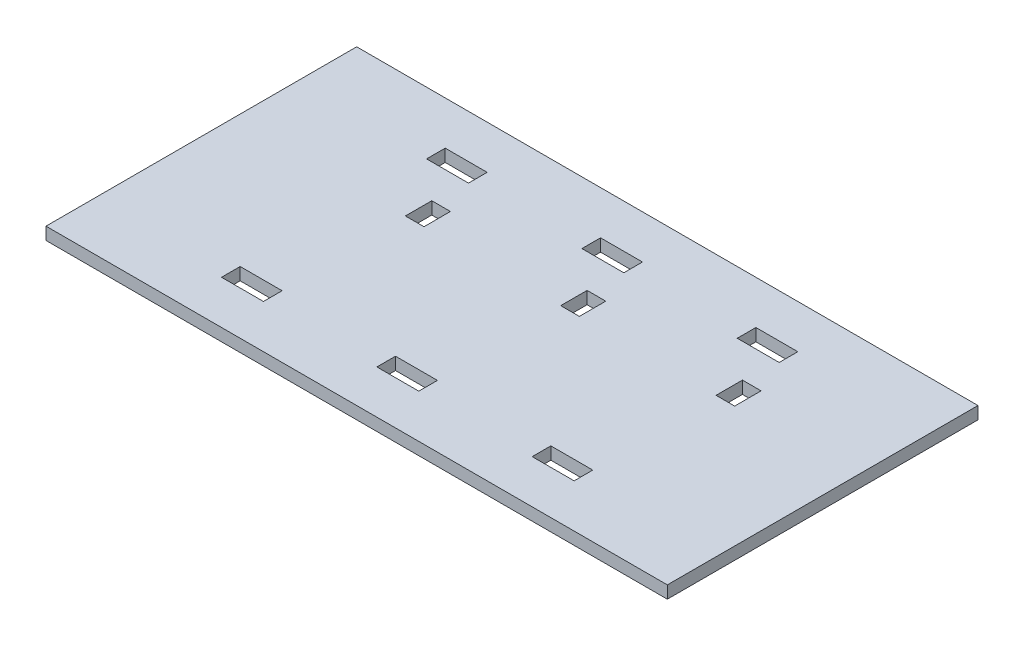
from build123d import *

# Parameters (mm, degrees)
SKETCH1_W                 = 101.6
SKETCH1_H                 = 50.8
BOSS_EXTRUDE1_DEPTH       = 2.032
SKETCH2_W                 = 3.048
SKETCH2_H                 = 4.318
WIRE_HOLE_DEPTH           = 57.832464525
SKETCH3_W                 = 6.858
SKETCH3_H                 = 3.048
CUT_EXTRUDE2_DEPTH        = 57.832464525
LPATTERN1_COUNT           = 2
LPATTERN1_PITCH           = 25.4
LPATTERN1_COUNT_DIR2      = 2
LPATTERN1_PITCH_DIR2      = 25.4
LPATTERN1_COPY_1_SKETCH_W = 6.858
LPATTERN1_COPY_1_SKETCH_H = 3.048
LPATTERN1_COPY_1_DEPTH    = 57.832464525
LPATTERN1_COPY_2_SKETCH_W = 6.858
LPATTERN1_COPY_2_SKETCH_H = 3.048
LPATTERN1_COPY_2_DEPTH    = 57.832464525
LPATTERN1_COPY_3_SKETCH_W = 6.858
LPATTERN1_COPY_3_SKETCH_H = 3.048
LPATTERN1_COPY_3_DEPTH    = 57.832464525


with BuildPart() as part:
    # Sketch1 → Boss-Extrude1 (new body)
    with BuildSketch(Plane(origin=(0, 0, 0), x_dir=(1, 0, 0), z_dir=(0, 1, 0))):
        Rectangle(SKETCH1_W, SKETCH1_H)
    extrude(amount=BOSS_EXTRUDE1_DEPTH)

    # Sketch2 → Wire Hole (cut, through all)
    with BuildSketch(Plane(origin=(0, 2.032, 0), x_dir=(1, 0, 0), z_dir=(0, 1, 0))):
        with Locations((4.064, 7.584002246)):
            Rectangle(SKETCH2_W, SKETCH2_H)
    wire_hole = extrude(amount=-WIRE_HOLE_DEPTH, mode=Mode.SUBTRACT)

    # Sketch3 → Cut-Extrude2 (cut, through all)
    with BuildSketch(Plane(origin=(0, 2.032, 0), x_dir=(1, 0, 0), z_dir=(0, 1, 0))):
        with Locations((-0.381, 16.764)):
            Rectangle(SKETCH3_W, SKETCH3_H)
    cut_extrude2 = extrude(amount=-CUT_EXTRUDE2_DEPTH, mode=Mode.SUBTRACT)

    # Mirror1: Cut-Extrude2 across plane
    add(cut_extrude2.mirror(Plane.XY), mode=Mode.SUBTRACT)

    # LPattern1: Wire Hole, Cut-Extrude2 2 × 2
    with Locations(*[Vector(-1, 0, 0) * (i * LPATTERN1_PITCH) + Vector(1, 0, 0) * (j * LPATTERN1_PITCH_DIR2) for i in range(LPATTERN1_COUNT) for j in range(LPATTERN1_COUNT_DIR2) if (i, j) != (0, 0)]):
        add(wire_hole, mode=Mode.SUBTRACT)
        add(cut_extrude2, mode=Mode.SUBTRACT)

    # LPattern1 copy 1 sketch → LPattern1 copy 1 (cut, through all)
    with BuildSketch(Plane(origin=(25.4, 2.032, 0), x_dir=(1, 0, 0), z_dir=(0, 1, 0))):
        with Locations((-0.381, -16.764)):
            Rectangle(LPATTERN1_COPY_1_SKETCH_W, LPATTERN1_COPY_1_SKETCH_H)
    extrude(amount=-LPATTERN1_COPY_1_DEPTH, mode=Mode.SUBTRACT)

    # LPattern1 copy 2 sketch → LPattern1 copy 2 (cut, through all)
    with BuildSketch(Plane(origin=(-25.4, 2.032, 0), x_dir=(1, 0, 0), z_dir=(0, 1, 0))):
        with Locations((-0.381, -16.764)):
            Rectangle(LPATTERN1_COPY_2_SKETCH_W, LPATTERN1_COPY_2_SKETCH_H)
    extrude(amount=-LPATTERN1_COPY_2_DEPTH, mode=Mode.SUBTRACT)

    # LPattern1 copy 3 sketch → LPattern1 copy 3 (cut, through all)
    with BuildSketch(Plane(origin=(0, 2.032, 0), x_dir=(1, 0, 0), z_dir=(0, 1, 0))):
        with Locations((-0.381, -16.764)):
            Rectangle(LPATTERN1_COPY_3_SKETCH_W, LPATTERN1_COPY_3_SKETCH_H)
    extrude(amount=-LPATTERN1_COPY_3_DEPTH, mode=Mode.SUBTRACT)


solid = part.part
